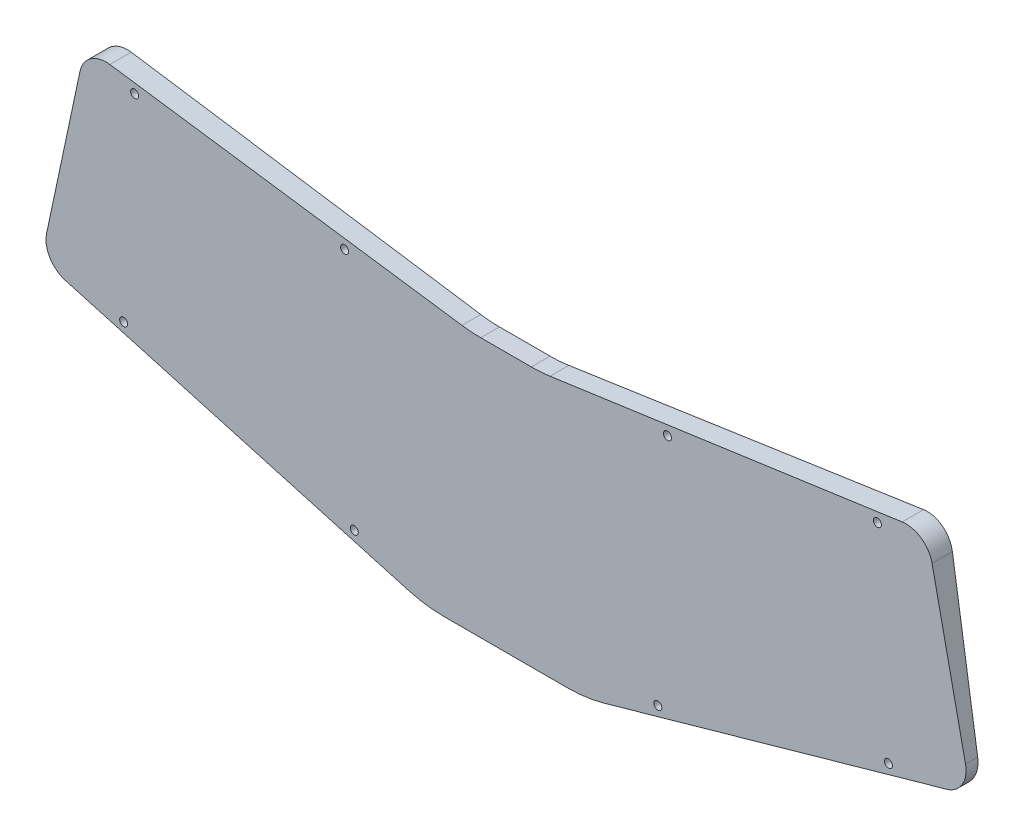
from build123d import *

# Parameters (mm, degrees)
MODEL_R                 = 1.5
BOSS_EXTRUDE1_DEPTH     = 8
MODEL_3_R               = 1.5
BOSS_EXTRUDE2_DEPTH     = 8
CUT_EXTRUDE2_DEPTH      = 341.706541914
CUT_EXTRUDE2_DEPTH_BACK = 341.706541914


with BuildPart() as part:
    # Model → Boss-Extrude1 (new body)
    with BuildSketch(Plane.XY):
        with BuildLine():
            Line((332.060338107, 8.179016053), (319.565261174, 66.96373151))
            ThreePointArc((319.565261174, 66.96373151), (315.515297863, 73.079110459), (308.381777137, 74.78584552))
            Line((308.381777137, 74.78584552), (176.614039179, 56.12761726))
            ThreePointArc((176.614039179, 56.12761726), (173.117705991, 55.75738597), (169.603999044, 55.6337718))
            Line((169.603999044, 55.6337718), (150.648829756, 55.6337718))
            ThreePointArc((150.648829756, 55.6337718), (147.135122809, 55.75738597), (143.63878962, 56.12761726))
            Line((143.63878962, 56.12761726), (11.871051663, 74.785845521))
            ThreePointArc((11.871051663, 74.785845521), (4.737530938, 73.07911046), (0.687567627, 66.963731511))
            Line((0.687567627, 66.963731511), (-11.807509307, 8.179016053))
            ThreePointArc((-11.807509307, 8.179016053), (-10.587273101, 0.932194341), (-4.743504981, -3.523787647))
            Line((-4.743504981, -3.523787647), (123.463014033, -39.725878608))
            ThreePointArc((123.463014033, -39.725878608), (130.191863147, -41.134819356), (137.050372447, -41.6074446))
            Line((137.050372447, -41.6074446), (183.202456353, -41.6074446))
            ThreePointArc((183.202456353, -41.6074446), (190.060965653, -41.134819356), (196.789814767, -39.725878608))
            Line((196.789814767, -39.725878608), (324.996333781, -3.523787647))
            ThreePointArc((324.996333781, -3.523787647), (330.840101901, 0.932194341), (332.060338107, 8.179016053))
        make_face()
        with Locations((103.335575354, -30.405568574)):
            Circle(MODEL_R, mode=Mode.SUBTRACT)
        with Locations((17.039281052, -6.037803815)):
            Circle(MODEL_R, mode=Mode.SUBTRACT)
        with Locations((216.917253446, -30.405568574)):
            Circle(MODEL_R, mode=Mode.SUBTRACT)
        with Locations((303.213547748, -6.037803815)):
            Circle(MODEL_R, mode=Mode.SUBTRACT)
        with Locations((21.146353911, 69.937554571)):
            Circle(MODEL_R, mode=Mode.SUBTRACT)
        with Locations((99.718342652, 58.811810716)):
            Circle(MODEL_R, mode=Mode.SUBTRACT)
        with Locations((220.534486148, 58.811810716)):
            Circle(MODEL_R, mode=Mode.SUBTRACT)
        with Locations((299.10647489, 69.93755457)):
            Circle(MODEL_R, mode=Mode.SUBTRACT)
    extrude(amount=BOSS_EXTRUDE1_DEPTH)

    # Model<3> → Boss-Extrude2 (add)
    with BuildSketch(Plane.XY):
        with BuildLine():
            Line((332.060338107, 8.179016053), (325.312640255, 39.924438699))
            Line((325.312640255, 39.924438699), (319.565261174, 66.96373151))
            ThreePointArc((319.565261174, 66.96373151), (315.515297863, 73.079110459), (308.381777137, 74.78584552))
            Line((308.381777137, 74.78584552), (176.614039179, 56.12761726))
            ThreePointArc((176.614039179, 56.12761726), (173.117705991, 55.75738597), (169.603999044, 55.6337718))
            Line((169.603999044, 55.6337718), (150.648829756, 55.6337718))
            ThreePointArc((150.648829756, 55.6337718), (147.135122809, 55.75738597), (143.63878962, 56.12761726))
            Line((143.63878962, 56.12761726), (11.871051663, 74.785845521))
            ThreePointArc((11.871051663, 74.785845521), (4.737530938, 73.07911046), (0.687567627, 66.963731511))
            Line((0.687567627, 66.963731511), (-5.059811455, 39.924438699))
            Line((-5.059811455, 39.924438699), (-11.807509307, 8.179016053))
            ThreePointArc((-11.807509307, 8.179016053), (-10.587273101, 0.932194341), (-4.743504981, -3.523787647))
            Line((-4.743504981, -3.523787647), (47.488623446, -18.272743308))
            Line((47.488623446, -18.272743308), (123.463014033, -39.725878608))
            ThreePointArc((123.463014033, -39.725878608), (130.191863147, -41.134819356), (137.050372447, -41.6074446))
            Line((137.050372447, -41.6074446), (160.1264144, -41.6074446))
            Line((160.1264144, -41.6074446), (183.202456353, -41.6074446))
            ThreePointArc((183.202456353, -41.6074446), (190.060965653, -41.134819356), (196.789814767, -39.725878608))
            Line((196.789814767, -39.725878608), (272.764205354, -18.272743308))
            Line((272.764205354, -18.272743308), (324.996333781, -3.523787647))
            ThreePointArc((324.996333781, -3.523787647), (330.840101901, 0.932194341), (332.060338107, 8.179016053))
        make_face()
        with Locations((103.335575354, -30.405568574)):
            Circle(MODEL_3_R, mode=Mode.SUBTRACT)
        with Locations((17.039281052, -6.037803815)):
            Circle(MODEL_3_R, mode=Mode.SUBTRACT)
        with Locations((216.917253446, -30.405568574)):
            Circle(MODEL_3_R, mode=Mode.SUBTRACT)
        with Locations((303.213547748, -6.037803815)):
            Circle(MODEL_3_R, mode=Mode.SUBTRACT)
        with Locations((21.146353911, 69.937554571)):
            Circle(MODEL_3_R, mode=Mode.SUBTRACT)
        with Locations((99.718342652, 58.811810716)):
            Circle(MODEL_3_R, mode=Mode.SUBTRACT)
        with BuildLine():
            Line((316.630818371, 66.339996441), (322.378197452, 39.30070363))
            Line((322.378197452, 39.30070363), (329.125895305, 7.555280983))
            ThreePointArc((329.125895305, 7.555280983), (328.27172996, 2.482505785), (324.181092276, -0.636681606))
            Line((324.181092276, -0.636681606), (312.778670176, -3.85642055))
            ThreePointArc((312.778670176, -3.85642055), (308.939676687, -4.169644175), (305.26707195, -3.008629753))
            ThreePointArc((305.26707195, -3.008629753), (302.26243266, -2.669513434), (299.878929754, -4.530096956))
            ThreePointArc((299.878929754, -4.530096956), (297.356002421, -7.440563881), (293.920172489, -9.18155576))
            Line((293.920172489, -9.18155576), (271.948963849, -15.385637267))
            Line((271.948963849, -15.385637267), (226.482375873, -28.224185309))
            ThreePointArc((226.482375873, -28.224185309), (222.643382385, -28.537408934), (218.970777647, -27.376394512))
            ThreePointArc((218.970777647, -27.376394512), (215.966138357, -27.037278193), (213.582635451, -28.897861715))
            ThreePointArc((213.582635451, -28.897861715), (211.059708119, -31.80832864), (207.623878187, -33.549320519))
            Line((207.623878187, -33.549320519), (195.974573262, -36.838772567))
            ThreePointArc((195.974573262, -36.838772567), (189.649455095, -38.16317687), (183.202456353, -38.6074446))
            Line((183.202456353, -38.6074446), (160.1264144, -38.6074446))
            Line((160.1264144, -38.6074446), (137.050372447, -38.6074446))
            ThreePointArc((137.050372447, -38.6074446), (130.603373705, -38.16317687), (124.278255538, -36.838772567))
            Line((124.278255538, -36.838772567), (112.628950613, -33.549320519))
            ThreePointArc((112.628950613, -33.549320519), (109.193120681, -31.80832864), (106.670193349, -28.897861715))
            ThreePointArc((106.670193349, -28.897861715), (104.286690443, -27.037278193), (101.282051153, -27.376394512))
            ThreePointArc((101.282051153, -27.376394512), (97.609446415, -28.537408934), (93.770452927, -28.224185309))
            Line((93.770452927, -28.224185309), (48.303864951, -15.385637267))
            Line((48.303864951, -15.385637267), (26.332656311, -9.18155576))
            ThreePointArc((26.332656311, -9.18155576), (22.896826379, -7.440563881), (20.373899046, -4.530096956))
            ThreePointArc((20.373899046, -4.530096956), (17.99039614, -2.669513434), (14.98575685, -3.008629753))
            ThreePointArc((14.98575685, -3.008629753), (11.313152113, -4.169644175), (7.474158624, -3.85642055))
            Line((7.474158624, -3.85642055), (-3.928263476, -0.636681606))
            ThreePointArc((-3.928263476, -0.636681606), (-8.01890116, 2.482505785), (-8.873066505, 7.555280983))
            Line((-8.873066505, 7.555280983), (-2.125368652, 39.30070363))
            Line((-2.125368652, 39.30070363), (3.622010429, 66.339996442))
            ThreePointArc((3.622010429, 66.339996442), (6.456984747, 70.620761706), (11.450449255, 71.815476249))
            Line((11.450449255, 71.815476249), (13.807051559, 71.481782855))
            ThreePointArc((13.807051559, 71.481782855), (16.05801748, 70.566743382), (17.611829082, 68.698638909))
            ThreePointArc((17.611829082, 68.698638909), (20.250303311, 66.551050421), (23.587647853, 67.21121251))
            ThreePointArc((23.587647853, 67.21121251), (27.071325394, 68.854371308), (30.917639732, 69.058934404))
            Line((30.917639732, 69.058934404), (90.087257633, 60.680553975))
            ThreePointArc((90.087257633, 60.680553975), (93.725570339, 59.416172428), (96.616102068, 56.870429634))
            ThreePointArc((96.616102068, 56.870429634), (99.227639842, 55.346379898), (102.159636594, 56.085468655))
            ThreePointArc((102.159636594, 56.085468655), (105.643314135, 57.728627453), (109.489628473, 57.933190549))
            Line((109.489628473, 57.933190549), (143.218187212, 53.157247988))
            ThreePointArc((143.218187212, 53.157247988), (146.924300392, 52.76480282), (150.648829756, 52.6337718))
            Line((150.648829756, 52.6337718), (169.603999044, 52.6337718))
            ThreePointArc((169.603999044, 52.6337718), (173.328528408, 52.76480282), (177.034641588, 53.157247988))
            Line((177.034641588, 53.157247988), (210.763200327, 57.933190549))
            ThreePointArc((210.763200327, 57.933190549), (214.609514665, 57.728627453), (218.093192206, 56.085468655))
            ThreePointArc((218.093192206, 56.085468655), (221.025188958, 55.346379898), (223.636726732, 56.870429634))
            ThreePointArc((223.636726732, 56.870429634), (226.52725846, 59.416172428), (230.165571167, 60.680553974))
            Line((230.165571167, 60.680553974), (289.335189068, 69.058934403))
            ThreePointArc((289.335189068, 69.058934403), (293.181503406, 68.854371307), (296.665180948, 67.211212509))
            ThreePointArc((296.665180948, 67.211212509), (300.002525489, 66.55105042), (302.640999718, 68.698638908))
            ThreePointArc((302.640999718, 68.698638908), (304.19481132, 70.566743381), (306.445777241, 71.481782853))
            Line((306.445777241, 71.481782853), (308.802379545, 71.815476247))
            ThreePointArc((308.802379545, 71.815476247), (313.795844053, 70.620761705), (316.630818371, 66.339996441))
        make_face(mode=Mode.SUBTRACT)
        with Locations((220.534486148, 58.811810716)):
            Circle(MODEL_3_R, mode=Mode.SUBTRACT)
        with Locations((299.10647489, 69.93755457)):
            Circle(MODEL_3_R, mode=Mode.SUBTRACT)
    extrude(amount=BOSS_EXTRUDE2_DEPTH)

    # Sketch2 → Cut-Extrude2 (cut, two sides: drawn at the far end of the back side and taken through both)
    with BuildSketch(Plane(origin=(0, 0, 0), x_dir=(0, 0, -1), z_dir=(1, 0, 0)).offset(-CUT_EXTRUDE2_DEPTH_BACK)):
        Polygon((-6, -41.6074446), (0, -41.6074446), (0, 74.884614612), align=None)
    extrude(amount=CUT_EXTRUDE2_DEPTH + CUT_EXTRUDE2_DEPTH_BACK, mode=Mode.SUBTRACT)


solid = part.part
